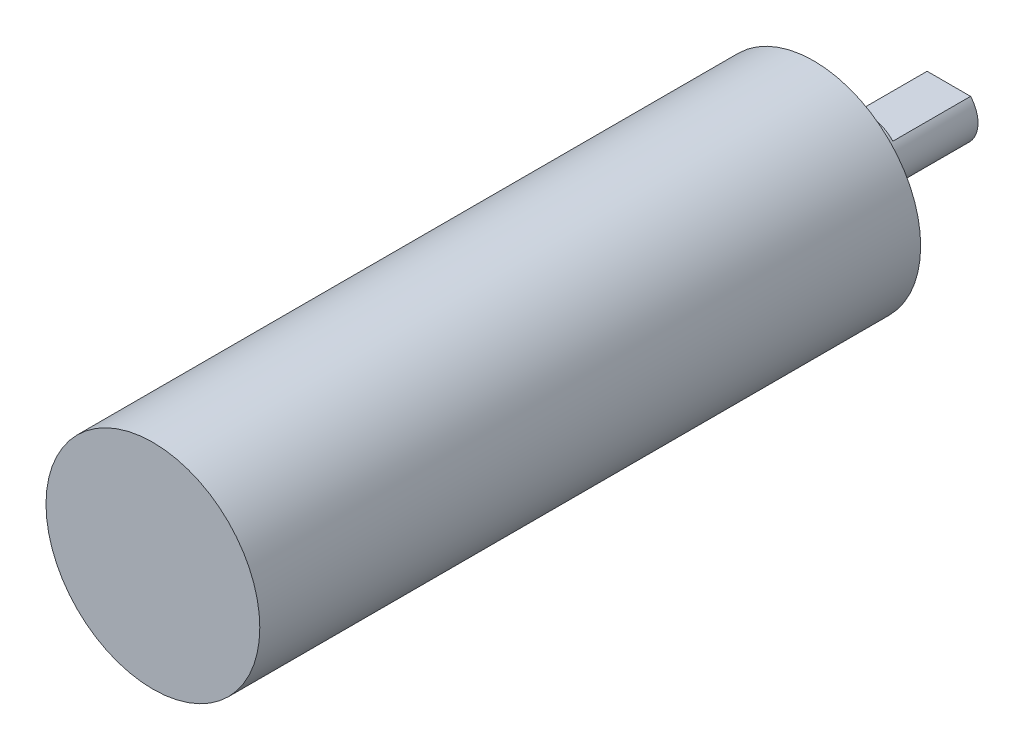
from build123d import *

# Parameters (mm, degrees)
SKETCH1_R           = 11
BOSS_EXTRUDE1_DEPTH = 68
SKETCH3_R           = 6
BOSS_EXTRUDE2_DEPTH = 3.5
SKETCH4_R           = 3
BOSS_EXTRUDE3_DEPTH = 10.4
CUT_EXTRUDE1_START  = -8
CUT_EXTRUDE1_DEPTH  = 8


with BuildPart() as part:
    # Sketch1 → Boss-Extrude1 (new body)
    with BuildSketch(Plane.XY):
        Circle(SKETCH1_R)
    extrude(amount=BOSS_EXTRUDE1_DEPTH)

    # Sketch3 → Boss-Extrude2 (add)
    with BuildSketch(Plane.XY):
        Circle(SKETCH3_R)
    extrude(amount=-BOSS_EXTRUDE2_DEPTH)

    # Sketch4 → Boss-Extrude3 (add)
    with BuildSketch(Plane(origin=(0, 0, -3.5), x_dir=(-1, 0, 0), z_dir=(0, 0, -1))):
        Circle(SKETCH4_R)
    extrude(amount=BOSS_EXTRUDE3_DEPTH)

    # Sketch5 → Cut-Extrude1 (cut)
    with BuildSketch(Plane(origin=(0, 0, -13.9), x_dir=(-1, 0, 0), z_dir=(0, 0, -1)).offset(CUT_EXTRUDE1_START)):
        with BuildLine():
            Line((-2.236067977, 2), (2.236067977, 2))
            ThreePointArc((2.236067977, 2), (0, 3), (-2.236067977, 2))
        make_face()
    extrude(amount=CUT_EXTRUDE1_DEPTH, mode=Mode.SUBTRACT)


solid = part.part
